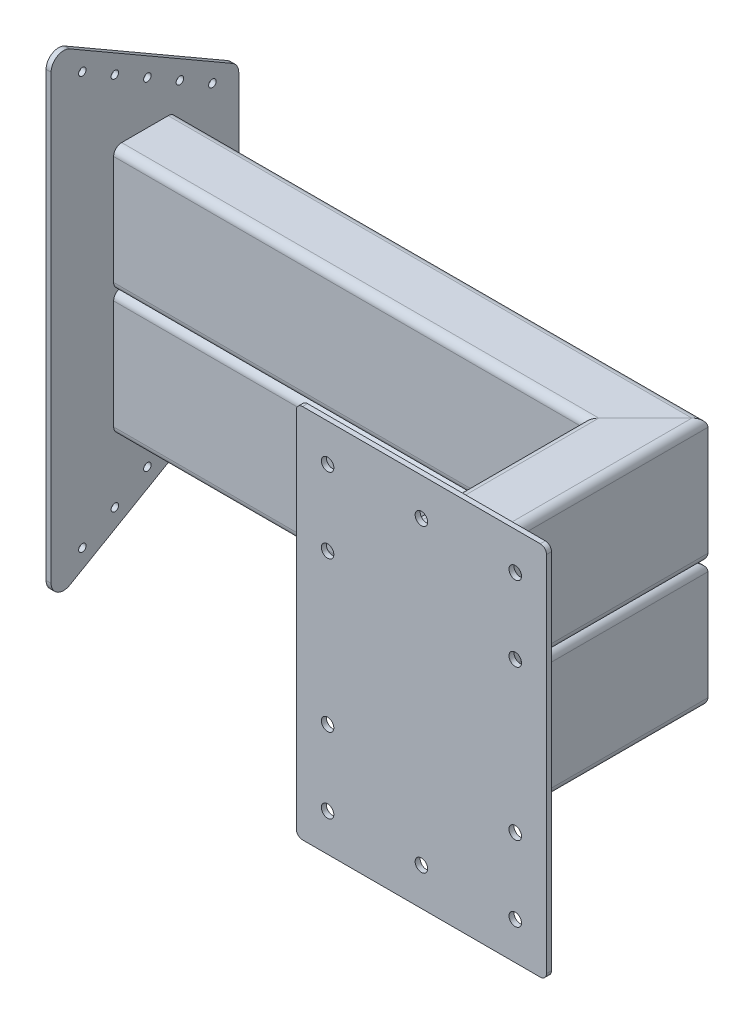
from build123d import *

# Parameters (mm, degrees)
TUBE_RECTANGULAR_100_X_50_X_3_2_3_DEPTH   = 456.901699437
TUBE_RECTANGULAR_100_X_50_X_3_2_3_2_DEPTH = 231.901699437
TUBE_RECTANGULAR_100_X_50_X_3_2_4_DEPTH   = 456.901699437
TUBE_RECTANGULAR_100_X_50_X_3_2_4_2_DEPTH = 231.901699437
BOSS_EXTRUDE1_DEPTH                       = 100
BOSS_EXTRUDE1_DEPTH_BACK                  = 300
SKETCH18_W                                = 200
SKETCH18_H                                = 4
BOSS_EXTRUDE1_2_DEPTH                     = 100
BOSS_EXTRUDE1_2_DEPTH_BACK                = 300
SKETCH18_W_2                              = 4
SKETCH18_H_2                              = 150
CHAMFER1_SIZE                             = 160
CHAMFER1_SIZE_2                           = 92.37604307
CHAMFER2_SIZE                             = 160
CHAMFER2_SIZE_2                           = 92.37604307
SKETCH21_R                                = 5
SKETCH21_W                                = 200.4
SKETCH21_H                                = 50
SKETCH21_W_2                              = 200
CUT_EXTRUDE2_DEPTH                        = 4
FILLET6_R                                 = 5
FILLET8_R                                 = 10
SKETCH22_R                                = 3
CUT_EXTRUDE3_DEPTH                        = 4


with BuildPart() as part:
    # Sketch11 → Tube (rectangular) 100 X 50 X 3.2(3) (new body)
    with BuildSketch(Plane(origin=(0, 0, 0), x_dir=(0, 0, -1), z_dir=(1, 0, 0))):
        with BuildLine():
            Line((-18.6, -50), (18.6, -50))
            ThreePointArc((18.6, -50), (23.1254834, -48.1254834), (25, -43.6))
            Line((25, -43.6), (25, 43.6))
            ThreePointArc((25, 43.6), (23.1254834, 48.1254834), (18.6, 50))
            Line((18.6, 50), (-18.6, 50))
            ThreePointArc((-18.6, 50), (-23.1254834, 48.1254834), (-25, 43.6))
            Line((-25, 43.6), (-25, -43.6))
            ThreePointArc((-25, -43.6), (-23.1254834, -48.1254834), (-18.6, -50))
        make_face()
        with BuildLine():
            Line((-18.6, -46.8), (18.6, -46.8))
            ThreePointArc((18.6, -46.8), (20.8627417, -45.8627417), (21.8, -43.6))
            Line((21.8, -43.6), (21.8, 43.6))
            ThreePointArc((21.8, 43.6), (20.8627417, 45.8627417), (18.6, 46.8))
            Line((18.6, 46.8), (-18.6, 46.8))
            ThreePointArc((-18.6, 46.8), (-20.8627417, 45.8627417), (-21.8, 43.6))
            Line((-21.8, 43.6), (-21.8, -43.6))
            ThreePointArc((-21.8, -43.6), (-20.8627417, -45.8627417), (-18.6, -46.8))
        make_face(mode=Mode.SUBTRACT)
    extrude(amount=TUBE_RECTANGULAR_100_X_50_X_3_2_3_DEPTH)

    # Tube (rectangular) 100 X 50 X 3.2(3) mitr
    split(bisect_by=Plane(origin=(400, 0, 0), x_dir=(0, -1, 0), z_dir=(-0.707106781, 0, -0.707106781)), keep=Keep.TOP)


with BuildPart() as body_2:
    # Sketch11 on segment 2 (carried to segment 2) → Tube _rectangular_ 100 X 50 X 3.2_3 2 (new body)
    with BuildSketch(Plane(origin=(400, 0, -56.901699437), x_dir=(1, 0, 0), z_dir=(0, 0, 1))):
        with BuildLine():
            Line((-18.6, -50), (18.6, -50))
            ThreePointArc((18.6, -50), (23.1254834, -48.1254834), (25, -43.6))
            Line((25, -43.6), (25, 43.6))
            ThreePointArc((25, 43.6), (23.1254834, 48.1254834), (18.6, 50))
            Line((18.6, 50), (-18.6, 50))
            ThreePointArc((-18.6, 50), (-23.1254834, 48.1254834), (-25, 43.6))
            Line((-25, 43.6), (-25, -43.6))
            ThreePointArc((-25, -43.6), (-23.1254834, -48.1254834), (-18.6, -50))
        make_face()
        with BuildLine():
            Line((-18.6, -46.8), (18.6, -46.8))
            ThreePointArc((18.6, -46.8), (20.8627417, -45.8627417), (21.8, -43.6))
            Line((21.8, -43.6), (21.8, 43.6))
            ThreePointArc((21.8, 43.6), (20.8627417, 45.8627417), (18.6, 46.8))
            Line((18.6, 46.8), (-18.6, 46.8))
            ThreePointArc((-18.6, 46.8), (-20.8627417, 45.8627417), (-21.8, 43.6))
            Line((-21.8, 43.6), (-21.8, -43.6))
            ThreePointArc((-21.8, -43.6), (-20.8627417, -45.8627417), (-18.6, -46.8))
        make_face(mode=Mode.SUBTRACT)
    extrude(amount=TUBE_RECTANGULAR_100_X_50_X_3_2_3_2_DEPTH)

    # Tube _rectangular_ 100 X 50 X 3.2_3 2 mi
    split(bisect_by=Plane(origin=(400, 0, 0), x_dir=(0, 1, 0), z_dir=(0.707106781, 0, 0.707106781)), keep=Keep.TOP)


with BuildPart() as body_3:
    # Sketch14 → Tube (rectangular) 100 X 50 X 3.2(4) (new body)
    with BuildSketch(Plane(origin=(0, 100, 0), x_dir=(0, 0, -1), z_dir=(1, 0, 0))):
        with BuildLine():
            Line((-18.6, -50), (18.6, -50))
            ThreePointArc((18.6, -50), (23.1254834, -48.1254834), (25, -43.6))
            Line((25, -43.6), (25, 43.6))
            ThreePointArc((25, 43.6), (23.1254834, 48.1254834), (18.6, 50))
            Line((18.6, 50), (-18.6, 50))
            ThreePointArc((-18.6, 50), (-23.1254834, 48.1254834), (-25, 43.6))
            Line((-25, 43.6), (-25, -43.6))
            ThreePointArc((-25, -43.6), (-23.1254834, -48.1254834), (-18.6, -50))
        make_face()
        with BuildLine():
            Line((-18.6, -46.8), (18.6, -46.8))
            ThreePointArc((18.6, -46.8), (20.8627417, -45.8627417), (21.8, -43.6))
            Line((21.8, -43.6), (21.8, 43.6))
            ThreePointArc((21.8, 43.6), (20.8627417, 45.8627417), (18.6, 46.8))
            Line((18.6, 46.8), (-18.6, 46.8))
            ThreePointArc((-18.6, 46.8), (-20.8627417, 45.8627417), (-21.8, 43.6))
            Line((-21.8, 43.6), (-21.8, -43.6))
            ThreePointArc((-21.8, -43.6), (-20.8627417, -45.8627417), (-18.6, -46.8))
        make_face(mode=Mode.SUBTRACT)
    extrude(amount=TUBE_RECTANGULAR_100_X_50_X_3_2_4_DEPTH)

    # Tube (rectangular) 100 X 50 X 3.2(4) mitr
    split(bisect_by=Plane(origin=(400, 100, 0), x_dir=(0, -1, 0), z_dir=(-0.707106781, 0, -0.707106781)), keep=Keep.TOP)


with BuildPart() as body_4:
    # Sketch14 on segment 2 (carried to segment 2) → Tube _rectangular_ 100 X 50 X 3.2_4 2 (new body)
    with BuildSketch(Plane(origin=(400, 100, -56.901699437), x_dir=(1, 0, 0), z_dir=(0, 0, 1))):
        with BuildLine():
            Line((-18.6, -50), (18.6, -50))
            ThreePointArc((18.6, -50), (23.1254834, -48.1254834), (25, -43.6))
            Line((25, -43.6), (25, 43.6))
            ThreePointArc((25, 43.6), (23.1254834, 48.1254834), (18.6, 50))
            Line((18.6, 50), (-18.6, 50))
            ThreePointArc((-18.6, 50), (-23.1254834, 48.1254834), (-25, 43.6))
            Line((-25, 43.6), (-25, -43.6))
            ThreePointArc((-25, -43.6), (-23.1254834, -48.1254834), (-18.6, -50))
        make_face()
        with BuildLine():
            Line((-18.6, -46.8), (18.6, -46.8))
            ThreePointArc((18.6, -46.8), (20.8627417, -45.8627417), (21.8, -43.6))
            Line((21.8, -43.6), (21.8, 43.6))
            ThreePointArc((21.8, 43.6), (20.8627417, 45.8627417), (18.6, 46.8))
            Line((18.6, 46.8), (-18.6, 46.8))
            ThreePointArc((-18.6, 46.8), (-20.8627417, 45.8627417), (-21.8, 43.6))
            Line((-21.8, 43.6), (-21.8, -43.6))
            ThreePointArc((-21.8, -43.6), (-20.8627417, -45.8627417), (-18.6, -46.8))
        make_face(mode=Mode.SUBTRACT)
    extrude(amount=TUBE_RECTANGULAR_100_X_50_X_3_2_4_2_DEPTH)

    # Tube _rectangular_ 100 X 50 X 3.2_4 2 mi
    split(bisect_by=Plane(origin=(400, 100, 0), x_dir=(0, 1, 0), z_dir=(0.707106781, 0, 0.707106781)), keep=Keep.TOP)


with BuildPart() as body_5:
    # Sketch18 → Boss-Extrude1 (new, two sides: drawn at the far end of the back side and taken through both)
    with BuildSketch(Plane.XZ.offset(50).offset(-BOSS_EXTRUDE1_DEPTH_BACK)):
        with Locations((400, 177)):
            Rectangle(SKETCH18_W, SKETCH18_H)
    extrude(amount=BOSS_EXTRUDE1_DEPTH + BOSS_EXTRUDE1_DEPTH_BACK)

    # Sketch21 → Cut-Extrude2 (cut)
    with BuildSketch(Plane.XY.offset(179)):
        with Locations((325, 170)):
            Circle(SKETCH21_R)
        with Locations((400, 170)):
            Circle(SKETCH21_R)
        with Locations((475, 170)):
            Circle(SKETCH21_R)
        with Locations((400, -70)):
            Circle(SKETCH21_R)
        with Locations((475, -70)):
            Circle(SKETCH21_R)
        with Locations((325, -70)):
            Circle(SKETCH21_R)
        with Locations((325, 110)):
            Circle(SKETCH21_R)
        with Locations((475, 110)):
            Circle(SKETCH21_R)
        with Locations((325, -10)):
            Circle(SKETCH21_R)
        with Locations((475, -10)):
            Circle(SKETCH21_R)
        with Locations((399.8, 225)):
            Rectangle(SKETCH21_W, SKETCH21_H)
        with Locations((400, -125)):
            Rectangle(SKETCH21_W_2, SKETCH21_H)
    extrude(amount=-CUT_EXTRUDE2_DEPTH, mode=Mode.SUBTRACT)

    # Fillet6
    fillet6_edges = [body_5.edges().sort_by_distance(p)[0] for p in [
        (300, -100, 177),
        (500, -100, 177),
        (500, 200, 177),
        (300, 200, 177),
    ]]
    fillet(fillet6_edges, radius=FILLET6_R)


with BuildPart() as body_6:
    # Sketch18 → Boss-Extrude1 2 (new, two sides: drawn at the far end of the back side and taken through both)
    with BuildSketch(Plane.XZ.offset(50).offset(-BOSS_EXTRUDE1_2_DEPTH_BACK)):
        with Locations((-2, 0)):
            Rectangle(SKETCH18_W_2, SKETCH18_H_2)
    extrude(amount=BOSS_EXTRUDE1_2_DEPTH + BOSS_EXTRUDE1_2_DEPTH_BACK)

    # Chamfer1
    # the kernel refuses this chamfer: 160, 92.37604307 mm, written as the material it takes off along each edge
    with BuildSketch(Plane(origin=(-417.933720743, 250, -75), x_dir=(0, 0.019326765612700983, 0.9998132206222079), z_dir=(1, 0, 0))) as chamfer1_piece_1:
        Polygon((CHAMFER1_SIZE * 0.999813220622, CHAMFER1_SIZE * 0.0193267656127), (-CHAMFER1_SIZE_2 * 0.0193267656128, CHAMFER1_SIZE_2 * 0.999813220626), (0, 0), align=None)
    extrude(amount=831.867441487, mode=Mode.SUBTRACT)

    # Chamfer2
    # the kernel refuses this chamfer: 160, 92.37604307 mm, written as the material it takes off along each edge
    with BuildSketch(Plane(origin=(-417.933720743, -150, -75), x_dir=(0, -0.019326765612700636, 0.9998132206222079), z_dir=(1, 0, 0))) as chamfer2_piece_1:
        Polygon((CHAMFER2_SIZE * 0.999813220622, -CHAMFER2_SIZE * 0.0193267656127), (-CHAMFER2_SIZE_2 * 0.0193267656128, -CHAMFER2_SIZE_2 * 0.999813220626), (0, 0), align=None)
    extrude(amount=831.867441487, mode=Mode.SUBTRACT)

    # Fillet8
    fillet8_edges = [body_6.edges().sort_by_distance(p)[0] for p in [
        (-2, 157.62395693, -75),
        (-2, 244.226497308, 75),
        (-2, -144.226497308, 75),
        (-2, -57.62395693, -75),
    ]]
    fillet(fillet8_edges, radius=FILLET8_R)

    # Sketch22 → Cut-Extrude3 (cut)
    with BuildSketch(Plane(origin=(0, 0, 0), x_dir=(0, 0, -1), z_dir=(1, 0, 0))):
        with Locations((-50, -114.781633579)):
            Circle(SKETCH22_R)
        with Locations((-24.019237886, -99.781633579)):
            Circle(SKETCH22_R)
        with Locations((1.961524227, -84.781633579)):
            Circle(SKETCH22_R)
        with Locations((27.942286341, -69.781633579)):
            Circle(SKETCH22_R)
        with Locations((53.923048454, -54.781633579)):
            Circle(SKETCH22_R)
        with Locations((-50, 214.781633579)):
            Circle(SKETCH22_R)
        with Locations((-24.019237886, 199.781633579)):
            Circle(SKETCH22_R)
        with Locations((1.961524227, 184.781633579)):
            Circle(SKETCH22_R)
        with Locations((27.942286341, 169.781633579)):
            Circle(SKETCH22_R)
        with Locations((53.923048454, 154.781633579)):
            Circle(SKETCH22_R)
    extrude(amount=-CUT_EXTRUDE3_DEPTH, mode=Mode.SUBTRACT)


solid = Compound([part.part, body_2.part, body_3.part, body_4.part, body_5.part, body_6.part])
